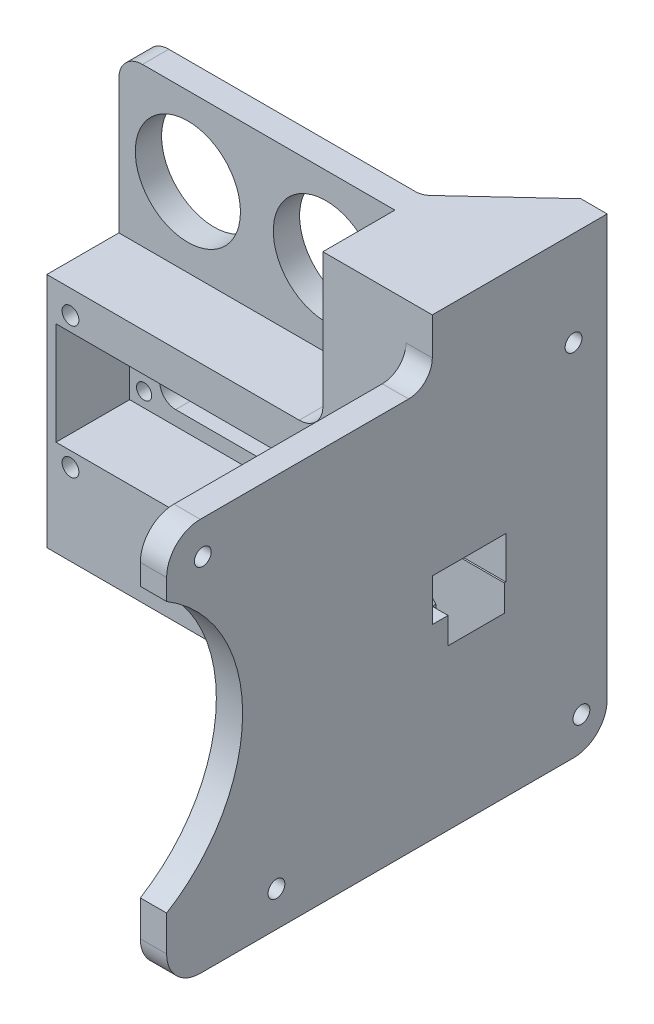
from build123d import *

# Parameters (mm, degrees)
BOSS_EXTRUDE1_DEPTH       = 1.5
BOSS_EXTRUDE1_DEPTH_BACK  = 3.2
SKETCH1_R                 = 1.45
SKETCH1_R_2               = 1.6000000000000019
SKETCH1_R_3               = 10.000000000000004
SKETCH1_R_4               = 10
BOSS_EXTRUDE2_OUTLINE_R   = 1.6
BOSS_EXTRUDE2_OUTLINE_R_2 = 10
BOSS_EXTRUDE2_DEPTH       = 14
SKETCH3_R                 = 1.5999999999999985
SKETCH3_R_2               = 1.5999999999999974
BOSS_EXTRUDE4_DEPTH       = 5
BOSS_EXTRUDE5_DEPTH       = 15.81
CUT_EXTRUDE1_DEPTH        = 106.99471761602163
CUT_EXTRUDE2_DEPTH        = 106.99471761602163
BOSS_EXTRUDE6_REACH       = 105.297
FILLET5_R                 = 3
FILLET6_R                 = 3
FILLET7_R                 = 3
SKETCH9_R                 = 2.7499999999999982
SKETCH9_R_2               = 2.7500000000000018
CUT_EXTRUDE3_DEPTH        = 4
SKETCH10_W                = 45.800000000000004
SKETCH10_H                = 33
BOSS_EXTRUDE7_DEPTH       = 3
SKETCH11_W                = 45.800000000000004
SKETCH11_H                = 33
SKETCH11_R                = 1.8999999999999984
BOSS_EXTRUDE8_DEPTH       = 8
CUT_EXTRUDE4_START        = -2
SKETCH12_R                = 1.8999999999999984
CUT_EXTRUDE4_DEPTH        = 2
BOSS_EXTRUDE9_START       = 5
BOSS_EXTRUDE9_DEPTH       = 5
CUT_EXTRUDE6_REACH        = 107.995
SKETCH18_R                = 3.4999999999999996
FILLET8_R                 = 4.5
CUT_EXTRUDE7_DEPTH        = 13.700000000000001
FILLET9_R                 = 4.5
FILLET10_R                = 4.5
CUT_EXTRUDE9_DEPTH        = 1
CUT_EXTRUDE10_DEPTH       = 104.2969877814071
CUT_EXTRUDE8_DEPTH        = 15
BOSS_EXTRUDE12_DEPTH      = 11
CHAMFER2_SIZE             = 8
BOSS_EXTRUDE13_REACH      = 103.024
FILLET11_R                = 10
CHAMFER3_SIZE             = 10
FILLET12_R                = 2
CHAMFER4_SIZE             = 8


# Read off the part's stored shape, not the designer's step: Boss-Extrude2
# Some blends are built 0.0001 mm under size
with BuildPart() as part:
    # Sketch1 → Boss-Extrude1 (new, two sides: drawn at the far end of the back side and taken through both)
    with BuildSketch(Plane.XY.offset(-BOSS_EXTRUDE1_DEPTH_BACK)):
        Polygon((-26.25, -17.000000000000007), (26.24999999999999, -17.000000000000007), (26.24999999999999, 16.999999999999996), (26.249999999999982, 47.00000000000001), (-26.25, 47), (-26.25, 16.999999999999996), align=None)
        with Locations((-21.749999999999996, 6.999999999999993)):
            Circle(SKETCH1_R, mode=Mode.SUBTRACT)
        with Locations((21.750000000000004, 6.999999999999998)):
            Circle(SKETCH1_R, mode=Mode.SUBTRACT)
        with Locations((21.750000000000004, -7.000000000000002)):
            Circle(SKETCH1_R, mode=Mode.SUBTRACT)
        with Locations((-21.749999999999996, -7.000000000000007)):
            Circle(SKETCH1_R, mode=Mode.SUBTRACT)
        with Locations((-21.75, 12.5)):
            Circle(SKETCH1_R_2, mode=Mode.SUBTRACT)
        with Locations((21.750000000000004, 12.5)):
            Circle(SKETCH1_R_2, mode=Mode.SUBTRACT)
        with Locations((21.750000000000004, -12.5)):
            Circle(SKETCH1_R_2, mode=Mode.SUBTRACT)
        with Locations((-21.749999999999996, -12.5)):
            Circle(SKETCH1_R_2, mode=Mode.SUBTRACT)
        with Locations((-13.125, 32)):
            Circle(SKETCH1_R_3, mode=Mode.SUBTRACT)
        with Locations((13.124999999999986, 32)):
            Circle(SKETCH1_R_4, mode=Mode.SUBTRACT)
        Polygon((18.749999999999986, 4.000000000000002), (18.749999999999986, 7), (-18.750000000000007, 7), (-18.750000000000007, -7.000000000000001), (18.749999999999986, -7.000000000000001), (18.749999999999986, -3.9999999999999982), (21.750000000000004, -3.9999999999999982), (21.750000000000004, 4.000000000000001), align=None, mode=Mode.SUBTRACT)
    extrude(amount=BOSS_EXTRUDE1_DEPTH + BOSS_EXTRUDE1_DEPTH_BACK)

    # Boss-Extrude2 outline → Boss-Extrude2 (add)
    with BuildSketch(Plane.XY.offset(1.5)):
        Polygon((-26.25, -17), (26.25, -17), (26.25, -4), (24.5, -4), (24.5, -9.75), (-24.5, -9.75), (-24.5, 9.75), (24.5, 9.75), (24.5, 4), (26.25, 4), (26.25, 47), (-26.25, 47), align=None)
        with Locations((-21.75, -12.5)):
            Circle(BOSS_EXTRUDE2_OUTLINE_R, mode=Mode.SUBTRACT)
        with Locations((-21.75, 12.5)):
            Circle(BOSS_EXTRUDE2_OUTLINE_R, mode=Mode.SUBTRACT)
        with Locations((21.75, -12.5)):
            Circle(BOSS_EXTRUDE2_OUTLINE_R, mode=Mode.SUBTRACT)
        with Locations((21.75, 12.5)):
            Circle(BOSS_EXTRUDE2_OUTLINE_R, mode=Mode.SUBTRACT)
        with Locations((-13.125, 32)):
            Circle(BOSS_EXTRUDE2_OUTLINE_R_2, mode=Mode.SUBTRACT)
        with Locations((13.125, 32)):
            Circle(BOSS_EXTRUDE2_OUTLINE_R_2, mode=Mode.SUBTRACT)
    extrude(amount=BOSS_EXTRUDE2_DEPTH)



with BuildPart() as body_2:
    # Sketch3 → Boss-Extrude4 (new body)
    with BuildSketch(Plane(origin=(47.05999999999999, 0, 45.55999999999999), x_dir=(0, 0, 1), z_dir=(-1, 0, 0))):
        with BuildLine():
            Line((-56.92, -39.400000000000006), (14.067449310874974, -39.400000000000006))
            ThreePointArc((14.067449310874974, -39.400000000000006), (18.592932710468883, -37.52548339959391), (20.467449310874972, -33))
            Line((20.467449310874972, -33), (20.46744931087497, 29.000000000000004))
            ThreePointArc((20.46744931087497, 29.000000000000004), (18.592932710468872, 33.5254833995939), (14.067449310874974, 35.4))
            Line((14.067449310874974, 35.4), (-56.92, 35.399999999999984))
            ThreePointArc((-56.92, 35.399999999999984), (-61.445483399593904, 33.525483399593895), (-63.32, 28.999999999999993))
            Line((-63.32, 28.999999999999993), (-63.32, -33))
            ThreePointArc((-63.32, -33), (-61.44548339959391, -37.52548339959391), (-56.92, -39.400000000000006))
        make_face()
        with Locations((13.579999999999995, 28.999999999999993)):
            Circle(SKETCH3_R, mode=Mode.SUBTRACT)
        with Locations((-0.4200000000000037, -32.7)):
            Circle(SKETCH3_R, mode=Mode.SUBTRACT)
        with Locations((-56.92, 28.99999999999999)):
            Circle(SKETCH3_R, mode=Mode.SUBTRACT)
        with Locations((-58.42000000000001, -33)):
            Circle(SKETCH3_R_2, mode=Mode.SUBTRACT)
    extrude(amount=BOSS_EXTRUDE4_DEPTH)


with BuildPart() as part_1:
    add(part.part)

    add(body_2.part)  # Boss-Extrude5 merges body 2
    # Sketch4 → Boss-Extrude5 (add)
    with BuildSketch(Plane(origin=(26.24999999999999, 0, 0), x_dir=(0, 0, -1), z_dir=(1, 0, 0))):
        Polygon((3.2, -17.000000000000007), (3.2, 47.000000000000014), (-15.5, 47.000000000000014), (-15.5, 4.000000000000002), (-1.5, 4.000000000000002), (-1.5, -3.9999999999999982), (-15.5, -3.9999999999999973), (-15.5, -17.000000000000007), align=None)
    extrude(amount=BOSS_EXTRUDE5_DEPTH)

    # Sketch5 → Cut-Extrude1 (cut, through all)
    with BuildSketch(Plane.ZY.offset(-42.059999999999995)):
        Polygon((1.5, -3.9999999999999982), (15.5, -3.9999999999999973), (15.5, 4.000000000000002), (1.5, 4.000000000000002), align=None)
    extrude(amount=-CUT_EXTRUDE1_DEPTH, mode=Mode.SUBTRACT)

    # Sketch7 → Cut-Extrude2 (cut, through all)
    with BuildSketch(Plane.ZY.offset(-42.059999999999995)):
        with BuildLine():
            Line((66.02744931087496, 25.057850732639817), (66.02744931087497, -26.257850732639824))
            ThreePointArc((66.02744931087497, -26.257850732639824), (51.57333930732014, -0.6000000000000159), (66.02744931087496, 25.057850732639817))
        make_face()
    extrude(amount=-CUT_EXTRUDE2_DEPTH, mode=Mode.SUBTRACT)

    # Boss-Extrude6: up to this face of the body (flat: up to its plane)
    boss_extrude6_end = Plane(part_1.part.faces().sort_by_distance((7.905, 47, 6.15))[0])
    # Sketch8 → Boss-Extrude6 (add, up to the picked face)
    with BuildSketch(Plane.XZ.offset(17.000000000000007), mode=Mode.PRIVATE) as boss_extrude6_sk1:
        Polygon((42.059999999999995, -11.360000000000008), (42.059999999999995, -17.760000000000012), (26.349999999999998, -3.2), (42.06000000000002, -3.2), align=None)
    boss_extrude6_tool1 = split(extrude(boss_extrude6_sk1.sketch, amount=-BOSS_EXTRUDE6_REACH, mode=Mode.PRIVATE), bisect_by=boss_extrude6_end, keep=Keep.BOTH, mode=Mode.PRIVATE)
    add(boss_extrude6_tool1.solids().sort_by(Axis((36.823333, -17, -8.053333), (0, 1, 0)))[0])

    # Fillet5
    fillet5_edges = [part_1.edges().sort_by_distance(p)[0] for p in [
        (26.349999999999998, 15, -3.2),
    ]]
    fillet(fillet5_edges, radius=FILLET5_R)

    # Fillet6
    fillet6_edges = [part_1.edges().sort_by_distance(p)[0] for p in [
        (-18.750000000000007, -7.000000000000001, -0.8500000000000001),
        (-18.750000000000007, 7, -0.8500000000000001),
        (18.749999999999986, 7, -0.8500000000000001),
        (18.749999999999986, -7.000000000000001, -0.8500000000000001),
    ]]
    fillet(fillet6_edges, radius=FILLET6_R - 0.0001)  # a hair under: the kernel refuses the full size

    # Fillet7
    fillet7_edges = [part_1.edges().sort_by_distance(p)[0] for p in [
        (18.749999999999986, -3.9999999999999982, -0.8500000000000001),
        (18.749999999999986, 4.000000000000002, -0.8500000000000001),
    ]]
    fillet(fillet7_edges, radius=FILLET7_R - 0.0001)  # a hair under: the kernel refuses the full size

    # Sketch9 → Cut-Extrude3 (cut)
    with BuildSketch(Plane(origin=(0, 0, -3.2), x_dir=(-1, 0, 0), z_dir=(0, 0, -1))):
        with Locations((-21.750000000000004, 12.5)):
            Circle(SKETCH9_R)
        with Locations((21.75, 12.5)):
            Circle(SKETCH9_R_2)
        with Locations((21.749999999999996, -12.5)):
            Circle(SKETCH9_R_2)
        with Locations((-21.750000000000004, -12.5)):
            Circle(SKETCH9_R_2)
    extrude(amount=-CUT_EXTRUDE3_DEPTH, mode=Mode.SUBTRACT)

    # Sketch10 → Boss-Extrude7 (add)
    with BuildSketch(Plane.XZ.offset(17.000000000000007)):
        with Locations((-3.3500000000000014, -0.9999999999999991)):
            Rectangle(SKETCH10_W, SKETCH10_H)
    extrude(amount=BOSS_EXTRUDE7_DEPTH)

    # Sketch11 → Boss-Extrude8 (add)
    with BuildSketch(Plane.XZ.offset(20.000000000000007)):
        with Locations((-3.3500000000000014, -0.9999999999999991)):
            Rectangle(SKETCH11_W, SKETCH11_H)
        with Locations(Location((-21.849999999999998, -1.0000000000000004, 0), (0, 0, 270))):
            Circle(SKETCH11_R, mode=Mode.SUBTRACT)
        with Locations(Location((15.15, -0.9999999999999974, 0), (0, 0, 270))):
            Circle(SKETCH11_R, mode=Mode.SUBTRACT)
        with BuildLine():
            Line((-21.849999999999998, 4), (-11.299999999999997, 4))
            Line((-11.299999999999997, 4), (-11.299999999999995, -5.999999999999997))
            Line((-11.299999999999995, -5.999999999999997), (-21.849999999999998, -6))
            Line((-21.849999999999998, -6), (-25.25, -6))
            Line((-25.25, -6), (-25.249999999999996, -16.5))
            Line((-25.249999999999996, -16.5), (18.55, -16.5))
            Line((18.55, -16.5), (18.55, -5.999999999999996))
            Line((18.55, -5.999999999999996), (15.15, -5.999999999999996))
            ThreePointArc((15.15, -5.999999999999996), (10.150000000000002, -0.9999999999999968), (15.15, 4.000000000000001))
            Line((15.15, 4.000000000000001), (18.55, 4.000000000000001))
            Line((18.55, 4.000000000000001), (18.55, 14.499999999999998))
            Line((18.55, 14.499999999999998), (-25.249999999999996, 14.499999999999998))
            Line((-25.249999999999996, 14.499999999999998), (-25.250000000000004, 4))
            Line((-25.250000000000004, 4), (-21.849999999999998, 4))
        make_face(mode=Mode.SUBTRACT)
    extrude(amount=BOSS_EXTRUDE8_DEPTH)

    # Sketch12 → Cut-Extrude4 (cut)
    with BuildSketch(Plane.XZ.offset(20.000000000000007).offset(CUT_EXTRUDE4_START)):
        with Locations(Location((15.15, -0.9999999999999974, 0), (0, 0, 270))):
            Circle(SKETCH12_R)
        with Locations(Location((-21.849999999999998, -1.0000000000000004, 0), (0, 0, 270))):
            Circle(SKETCH12_R)
    extrude(amount=CUT_EXTRUDE4_DEPTH, mode=Mode.SUBTRACT)

    # Sketch17 → Boss-Extrude9 (add)
    with BuildSketch(Plane(origin=(42.059999999999995, 0, 0), x_dir=(0, 0, -1), z_dir=(1, 0, 0)).offset(BOSS_EXTRUDE9_START)):
        with BuildLine():
            Line((-15.5, 35.39999999999999), (11.360000000000008, 35.399999999999984))
            ThreePointArc((11.360000000000008, 35.399999999999984), (15.88548339959391, 33.525483399593895), (17.760000000000005, 28.999999999999993))
            Line((17.760000000000005, 28.999999999999993), (17.760000000000012, 47.000000000000014))
            Line((17.760000000000012, 47.000000000000014), (-15.5, 47.000000000000014))
            Line((-15.5, 47.000000000000014), (-15.5, 35.39999999999999))
        make_face()
    extrude(amount=-BOSS_EXTRUDE9_DEPTH)

    # Cut-Extrude6: up to this plane
    cut_extrude6_end = Plane(origin=(42.059999999999995, 68.41956348761575, -17.760000000000012), z_dir=(-0.6797524145820368, 0, -0.7334416506238863))
    # Sketch18 → Cut-Extrude6 (cut, up to the surface)
    with BuildSketch(Plane(origin=(42.059999999999995, 0, 0), x_dir=(0, 0, -1), z_dir=(1, 0, 0)), mode=Mode.PRIVATE) as cut_extrude6_sk1:
        with Locations((11.360000000000008, 28.99999999999999)):
            Circle(SKETCH18_R)
    cut_extrude6_tool1 = split(extrude(cut_extrude6_sk1.sketch, amount=-CUT_EXTRUDE6_REACH, mode=Mode.PRIVATE), bisect_by=cut_extrude6_end, keep=Keep.BOTH, mode=Mode.PRIVATE)
    add(cut_extrude6_tool1.solids().sort_by_distance((42.06, 29, -11.36))[0], mode=Mode.SUBTRACT)

    # Fillet8
    fillet8_edges = [part_1.edges().sort_by_distance(p)[0] for p in [
        (44.559999999999995, 35.39999999999999, 15.5),
    ]]
    fillet(fillet8_edges, radius=FILLET8_R)

    # Sketch19 → Cut-Extrude7 (cut)
    with BuildSketch(Plane.XY.offset(15.5)):
        Polygon((-26.25, 47), (26.249999999999993, 47), (26.25, 16.999999999999993), (-26.249999999999996, 16.999999999999993), align=None)
    extrude(amount=-CUT_EXTRUDE7_DEPTH, mode=Mode.SUBTRACT)

    # Fillet9
    fillet9_edges = [part_1.edges().sort_by_distance(p)[0] for p in [
        (26.25, 16.999999999999993, 8.649999999999999),
    ]]
    fillet(fillet9_edges, radius=FILLET9_R)

    # Fillet10
    fillet10_edges = [part_1.edges().sort_by_distance(p)[0] for p in [
        (-26.25, 47, -0.6999999999999993),
    ]]
    fillet(fillet10_edges, radius=FILLET10_R)

    # Sketch22 → Cut-Extrude9 (cut)
    # profile 1 of 2: a face of its own
    with BuildSketch(Plane(origin=(0, 0, -3.2), x_dir=(-1, 0, 0), z_dir=(0, 0, -1))):
        with BuildLine():
            Line((-9.624999999999984, 17.774837146068666), (-9.624999999999984, 16.717545479402))
            add(Edge.make_bspline(
                [(-9.624999999999984, 16.717545479402), (-9.625152878327658, 16.646732360171466), (-9.625445524145881, 16.51117905099027), (-9.627140056004405, 16.316712421287114), (-9.631873097196374, 16.140280179348593), (-9.636005509644358, 15.981536666036872), (-9.64352447421801, 15.840639159973225), (-9.650574582443763, 15.717384906292635), (-9.660054235232517, 15.612130636597728), (-9.668737978890592, 15.548284302015713), (-9.672676282051265, 15.519328331966099)],
                knots=[0, 0, 0, 0, 1.4163343391444696, 2.7112039218747914, 3.889472771830395, 4.946381420146892, 5.887086879162432, 6.711376891967713, 7.415575970559515, 8, 8, 8, 8], degree=3))
            add(Edge.make_bspline(
                [(-9.672676282051265, 15.519328331966099), (-9.678975180484858, 15.480674087475084), (-9.69133880652921, 15.404802626940786), (-9.717689225268401, 15.294659534410505), (-9.748408288440322, 15.189987434924777), (-9.78398578533403, 15.0907337619178), (-9.825464234679824, 14.997352354098034), (-9.872023732569653, 14.909397811308544), (-9.922706094227705, 14.826314004957531), (-9.979739409955256, 14.75045523171758), (-10.039376608395179, 14.680488330585458), (-10.103944541022207, 14.620238000673503), (-10.171761764703888, 14.56900855485059), (-10.24322643106501, 14.527485385527376), (-10.317542965174173, 14.494132585651593), (-10.395746417444881, 14.470676471406325), (-10.477346653714056, 14.457464872756384), (-10.53290687745109, 14.4553789487963), (-10.56099759615383, 14.454324325555843)],
                knots=[0, 0, 0, 0, 1.24203140620111, 2.437888466293663, 3.589706734764333, 4.701335532199242, 5.780040667360259, 6.828015678552637, 7.856722270012474, 8.863529500979672, 9.835758706010107, 10.769429789693339, 11.659088762431569, 12.526284451408666, 13.385936535632784, 14.237365168980151, 15.10882865684315, 15.999999999999998, 15.999999999999998, 15.999999999999998, 15.999999999999998], degree=3))
            add(Edge.make_bspline(
                [(-10.56099759615383, 14.454324325555843), (-10.584637097408082, 14.455030872488031), (-10.631418468855395, 14.456429092954869), (-10.700436178745832, 14.466589143589845), (-10.767166748144412, 14.48255786194618), (-10.831795004746946, 14.505298060185298), (-10.894050948861892, 14.534677353385916), (-10.954077397628815, 14.571065820237068), (-11.012292780118356, 14.612922187955819), (-11.06783803585739, 14.66159892332569), (-11.120285976472067, 14.716517479169648), (-11.170199264692107, 14.776807167163097), (-11.216474673243011, 14.842999048347231), (-11.259315023309162, 14.914715695303137), (-11.298418702845861, 14.992225537043781), (-11.33483657992539, 15.074783180238086), (-11.367965361674809, 15.162983817293624), (-11.397438669283273, 15.257316459546574), (-11.423374953876314, 15.359396383183014), (-11.446625719778613, 15.469718705679636), (-11.465027189721628, 15.589642064971523), (-11.481280759351716, 15.718432181165507), (-11.493692206549317, 15.856647156301213), (-11.502672248311768, 16.003941645293416), (-11.508340017148353, 16.16034354560265), (-11.509182388336576, 16.267654071009808), (-11.509615384615369, 16.322813908889177)],
                knots=[0, 0, 0, 0, 0.7323391168272214, 1.4492618892934048, 2.1571293616194027, 2.855711579249913, 3.5684155038357703, 4.286288666363024, 5.027985423995437, 5.787603267966051, 6.5712480402867035, 7.378886803275337, 8.210678650034938, 9.071382144113016, 9.96529425200122, 10.899149031125006, 11.866276500870272, 12.883257392887783, 13.959981898347795, 15.12891109836355, 16.375484438926165, 17.71838499019596, 19.15100465839435, 20.67473878226197, 22.290746699999392, 24, 24, 24, 24], degree=3))
            Line((-11.509615384615369, 16.322813908889177), (-13.124999999999984, 14.409452530684048))
            Line((-13.124999999999984, 14.409452530684048), (-13.124999999999984, 15.040462146068664))
            Line((-13.124999999999984, 15.040462146068664), (-11.509615384615369, 16.95382352427379))
            Line((-11.509615384615369, 16.95382352427379), (-11.509615384615369, 17.28124740247892))
            Line((-11.509615384615369, 17.28124740247892), (-13.124999999999984, 17.28124740247892))
            Line((-13.124999999999984, 17.28124740247892), (-13.124999999999984, 17.774837146068666))
            Line((-13.124999999999984, 17.774837146068666), (-9.624999999999984, 17.774837146068666))
        make_face()
        with BuildLine():
            Line((-9.983974358974343, 17.28124740247892), (-11.15064102564101, 17.28124740247892))
            Line((-11.15064102564101, 17.28124740247892), (-11.155548878205112, 16.32912400504302))
            add(Edge.make_bspline(
                [(-11.155548878205112, 16.32912400504302), (-11.155565723551284, 16.28448211756968), (-11.155598273678779, 16.19822095592948), (-11.151583062899896, 16.073422261654613), (-11.147087236439706, 15.957692714762578), (-11.140069909486078, 15.850852982381907), (-11.131138941555438, 15.752870305379908), (-11.120048232497467, 15.663754968414615), (-11.106943987527425, 15.583707720401588), (-11.086863434411336, 15.490955093444596), (-11.05585522448119, 15.38755538059543), (-11.008930302681085, 15.275612445544366), (-10.951684188394065, 15.178354781562748), (-10.88487301695565, 15.096166603038318), (-10.81105852612096, 15.030617499573667), (-10.731610837410528, 14.982874829064864), (-10.647442440187975, 14.953009502721184), (-10.589274042778957, 14.949608390548326), (-10.560296474358958, 14.947914069145588)],
                knots=[0, 0, 0, 0, 1.294571988473012, 2.5014910854570913, 3.620829231136402, 4.653277533612743, 5.606247550790416, 6.473828703826713, 7.257152552669376, 7.957759031960975, 9.224984706773833, 10.381940474885862, 11.469936333027308, 12.486172621557552, 13.44193445505083, 14.317212128288414, 15.161690834526846, 16, 16, 16, 16], degree=3))
            add(Edge.make_bspline(
                [(-10.560296474358958, 14.947914069145588), (-10.531981541664763, 14.949530348482215), (-10.47502606776032, 14.952781493613786), (-10.393177241675605, 14.984057125713635), (-10.314843168390354, 15.031032820974486), (-10.24365854197572, 15.098174592060738), (-10.178016635582228, 15.178738475914889), (-10.122793683634798, 15.273202845571104), (-10.07692548835373, 15.378546174005315), (-10.048025742885194, 15.475563758510479), (-10.029813071826581, 15.562496033927204), (-10.017241500206243, 15.638967232925772), (-10.006959869769519, 15.725769495642815), (-9.998884300233236, 15.822606181841978), (-9.991715395294019, 15.929176583595009), (-9.987003320591073, 16.045834224684224), (-9.984175602106456, 16.172759254529883), (-9.984043191040929, 16.260879837599727), (-9.983974358974343, 16.306688107607123)],
                knots=[0, 0, 0, 0, 0.8341845673444583, 1.6779618680363244, 2.5586054507043787, 3.5223262964890916, 4.55418871799747, 5.623289454340097, 6.746763372792236, 7.94491800296359, 8.60910327556292, 9.372615810100926, 10.235839792933524, 11.19317081921977, 12.24592920079487, 13.394191630061167, 14.645406450578228, 16, 16, 16, 16], degree=3))
            Line((-9.983974358974343, 16.306688107607123), (-9.983974358974343, 17.28124740247892))
        make_face(mode=Mode.SUBTRACT)
    # profile 2 of 2: a face of its own
    with BuildSketch(Plane(origin=(0, 0, -3.2), x_dir=(-1, 0, 0), z_dir=(0, 0, -1))):
        Polygon((16.266025641025646, 17.662657658889177), (16.625000000000004, 17.662657658889177), (16.625000000000004, 14.835734581966102), (16.266025641025646, 14.835734581966102), (16.266025641025646, 16.002401248632765), (13.125000000000004, 16.002401248632765), (13.125000000000004, 16.49599099222251), (16.266025641025646, 16.49599099222251), align=None)
    extrude(amount=-CUT_EXTRUDE9_DEPTH, mode=Mode.SUBTRACT)

    # Sketch13 → Cut-Extrude10 (cut, through all)
    with BuildSketch(Plane.XZ.offset(17.000000000000007)):
        Polygon((42.059999999999995, 1.8000000000000045), (34.059999999999995, 1.8000000000000036), (34.059999999999995, 12.500000000000004), (42.059999999999995, 12.500000000000004), align=None)
    extrude(amount=-CUT_EXTRUDE10_DEPTH, mode=Mode.SUBTRACT)

    # Sketch20 → Cut-Extrude8 (cut)
    with BuildSketch(Plane.ZY.offset(-26.250000000000004)):
        Polygon((1.7999999999999992, 24.49999999999999), (12.500000000000005, 24.49999999999999), (12.500000000000005, 39.499999999999986), (1.799999999999999, 39.499999999999986), align=None)
    extrude(amount=-CUT_EXTRUDE8_DEPTH, mode=Mode.SUBTRACT)

    # Sketch23 → Boss-Extrude12 (add)
    with BuildSketch(Plane.XZ.offset(28.000000000000007)):
        with BuildLine():
            Line((42.059999999999995, 1.8000000000000043), (42.059999999999995, -17.760000000000012))
            Line((42.059999999999995, -17.760000000000012), (35.951837140360944, -12.098965548291252))
            ThreePointArc((35.951837140360944, -12.098965548291252), (33.1114733468525, -10.797452500959105), (30.05307506745077, -11.436046782488486))
            Line((30.05307506745077, -11.436046782488486), (19.55, -17.5))
            Line((19.55, -17.5), (19.55, -3.1999999999999997))
            Line((19.55, -3.1999999999999997), (19.55, 15.5))
            Line((19.55, 15.5), (42.05999999999999, 15.5))
            Line((42.05999999999999, 15.5), (42.059999999999995, 12.500000000000004))
            Line((42.059999999999995, 12.500000000000004), (34.059999999999995, 12.500000000000004))
            Line((34.059999999999995, 12.500000000000004), (34.059999999999995, 1.8000000000000036))
            Line((34.059999999999995, 1.8000000000000036), (42.059999999999995, 1.8000000000000043))
        make_face()
    extrude(amount=-BOSS_EXTRUDE12_DEPTH)

    # Chamfer2
    chamfer2_edges = [part_1.edges().sort_by_distance(p)[0] for p in [
        (18.55, -28.000000000000007, 9.25),
    ]]
    chamfer(chamfer2_edges, length=CHAMFER2_SIZE - 0.0001)  # a hair under: the kernel refuses the full size

    # Sketch24 → Boss-Extrude13 (add, up to next)
    with BuildSketch(Plane(origin=(34.059999999999995, 0, 0), x_dir=(0, 0, -1), z_dir=(1, 0, 0)), mode=Mode.PRIVATE) as boss_extrude13_sk1:
        Polygon((-12.500000000000005, 47.000000000000014), (-12.500000000000005, 39.49999999999999), (-1.8000000000000036, 39.49999999999999), (-1.8000000000000036, 47.00000000000002), align=None)
    boss_extrude13_tool1 = extrude(boss_extrude13_sk1.sketch, amount=BOSS_EXTRUDE13_REACH, mode=Mode.PRIVATE) - part_1.part
    add(boss_extrude13_tool1.solids().sort_by_distance((34.06, 43.25, 7.15))[0])

    # Fillet11
    fillet11_edges = [part_1.edges().sort_by_distance(p)[0] for p in [
        (42.059999999999995, 39.49999999999999, 7.150000000000004),
    ]]
    fillet(fillet11_edges, radius=FILLET11_R)

    # Chamfer3
    # the kernel refuses this chamfer: 10 mm, written as the material it takes off along each edge
    with BuildSketch(Plane(origin=(34.059999999999995, -4, 1.8000000000000036), x_dir=(-0.9996219169112968, 0.02749587661058636, 0), z_dir=(0, 0, 1))) as chamfer3_piece_1:
        Polygon((CHAMFER3_SIZE * 0.999621916911, CHAMFER3_SIZE * 0.0274958766106), (-CHAMFER3_SIZE * 0.0274958766106, CHAMFER3_SIZE * 0.999621916911), (0, 0), align=None)
    extrude(amount=10.7, mode=Mode.SUBTRACT)
    with BuildSketch(Plane(origin=(42.059999999999995, -4, 12.500000000000004), x_dir=(-0.02749587661058701, -0.9996219169112968, 0), z_dir=(0, 0, -1))) as chamfer3_piece_2:
        Polygon((CHAMFER3_SIZE * 0.999621916911, -CHAMFER3_SIZE * 0.0274958766106), (-CHAMFER3_SIZE * 0.0274958766106, -CHAMFER3_SIZE * 0.999621916911), (0, 0), align=None)
    extrude(amount=10.7, mode=Mode.SUBTRACT)

    # Fillet12
    fillet12_edges = [part_1.edges().sort_by_distance(p)[0] for p in [
        (-25.249999999999996, -24.000000000000007, -16.5),
        (-25.249999999999996, -24.000000000000007, 14.499999999999998),
    ]]
    fillet(fillet12_edges, radius=FILLET12_R)

    # Chamfer4
    chamfer4_edges = [part_1.edges().sort_by_distance(p)[0] for p in [
        (-11.299999999999997, -28.000000000000007, -0.9999999999999982),
    ]]
    chamfer(chamfer4_edges, length=CHAMFER4_SIZE - 0.0001)  # a hair under: the kernel refuses the full size


solid = part_1.part
